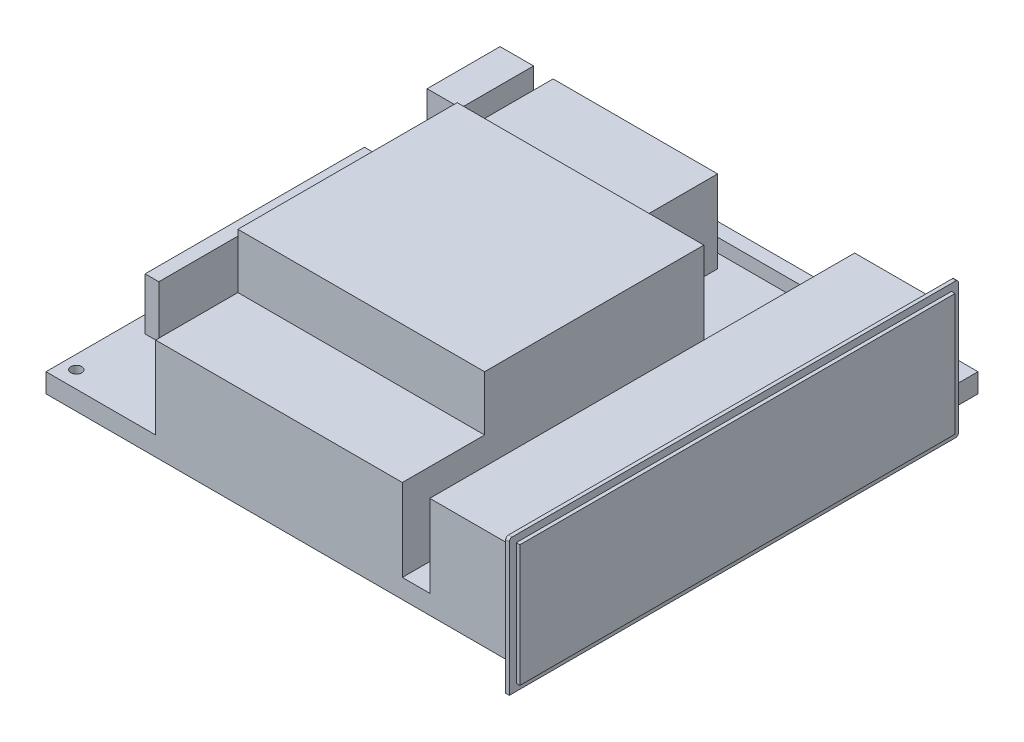
from build123d import *

# Parameters (mm, degrees)
SKETCH1_W                          = 170
SKETCH1_H                          = 170
ALUSPLAAT_DEPTH                    = 2
SKETCH2_W                          = 30
SKETCH2_H                          = 155
PISTIKUD_DEPTH                     = 35
SKETCH3_W                          = 90
SKETCH3_H                          = 110
CPU_M_LUD_DEPTH                    = 55
SKETCH4_W                          = 60
SKETCH4_H                          = 35
SININE_RADIKAS_DEPTH               = 35
SKETCH5_W                          = 90
SKETCH5_H                          = 5
PCIE_PESA_DEPTH                    = 10
SKETCH6_W                          = 12.216790721
SKETCH6_H                          = 26.62710746
RAID_PESAD_DEPTH                   = 30
SKETCH7_W                          = 170
SKETCH7_H                          = 170
LE_LDINE_M_RA_DEPTH                = 5
SKETCH8_W                          = 5
SKETCH8_H                          = 80
PATREI_JA_IGASUGUSED_L_LITID_DEPTH = 19
SKETCH9_OUTSIDE_W                  = 221.416
SKETCH9_OUTSIDE_H                  = 221.416
SKETCH9_OUTSIDE_W_2                = 90
SKETCH9_OUTSIDE_H_2                = 80
M_LUD_DEPTH                        = 20
CUT_EXTRUDE2_REACH                 = 132.192
SKETCH10_R                         = 1.98
BOSS_EXTRUDE1_DEPTH                = 1.32
SKETCH12_W                         = 158.75
SKETCH12_H                         = 44.45
BOSS_EXTRUDE2_DEPTH                = 1.32


with BuildPart() as part:
    # Sketch1 → alusplaat (new body)
    with BuildSketch(Plane(origin=(0, 0, 0), x_dir=(1, 0, 0), z_dir=(0, 1, 0))):
        Rectangle(SKETCH1_W, SKETCH1_H)
    extrude(amount=ALUSPLAAT_DEPTH)

    # Sketch2 → pistikud (add)
    with BuildSketch(Plane(origin=(0, 2, 0), x_dir=(-1, 0, 0), z_dir=(0, 1, 0))):
        with Locations((-70, 7.5)):
            Rectangle(SKETCH2_W, SKETCH2_H)
    extrude(amount=PISTIKUD_DEPTH)

    # Sketch3 → cpu+mälud (add)
    with BuildSketch(Plane(origin=(0, 2, 0), x_dir=(1, 0, 0), z_dir=(0, 1, 0))):
        with Locations((0, -30)):
            Rectangle(SKETCH3_W, SKETCH3_H)
    extrude(amount=CPU_M_LUD_DEPTH)

    # Sketch4 → sinine radikas (add)
    with BuildSketch(Plane(origin=(0, 2, 0), x_dir=(1, 0, 0), z_dir=(0, 1, 0))):
        with Locations((-25, 52.5)):
            Rectangle(SKETCH4_W, SKETCH4_H)
    extrude(amount=SININE_RADIKAS_DEPTH)

    # Sketch5 → pcie pesa (add)
    with BuildSketch(Plane(origin=(0, 2, 0), x_dir=(-1, 0, 0), z_dir=(0, 1, 0))):
        with Locations((0, -77.5)):
            Rectangle(SKETCH5_W, SKETCH5_H)
    extrude(amount=PCIE_PESA_DEPTH)

    # Sketch6 → raid pesad (add)
    with BuildSketch(Plane(origin=(0, 2, 0), x_dir=(-1, 0, 0), z_dir=(0, 1, 0))):
        with Locations((73.780405742, -62.225935716)):
            Rectangle(SKETCH6_W, SKETCH6_H)
    extrude(amount=RAID_PESAD_DEPTH)

    # Sketch7 → üleüldine müra (add)
    with BuildSketch(Plane(origin=(0, 2, 0), x_dir=(-1, 0, 0), z_dir=(0, 1, 0))):
        Rectangle(SKETCH7_W, SKETCH7_H)
    extrude(amount=LE_LDINE_M_RA_DEPTH)

    # Sketch8 → patrei ja igasugused lülitid (add)
    with BuildSketch(Plane(origin=(0, 7, 0), x_dir=(-1, 0, 0), z_dir=(0, 1, 0))):
        with Locations((76.340130234, 15)):
            Rectangle(SKETCH8_W, SKETCH8_H)
    extrude(amount=PATREI_JA_IGASUGUSED_L_LITID_DEPTH)

    # Sketch9 outside → mälud (cut)
    with BuildSketch(Plane(origin=(0, 57, 0), x_dir=(-1, 0, 0), z_dir=(0, 1, 0))):
        Rectangle(SKETCH9_OUTSIDE_W, SKETCH9_OUTSIDE_H)
        with Locations((0, 15)):
            Rectangle(SKETCH9_OUTSIDE_W_2, SKETCH9_OUTSIDE_H_2, mode=Mode.SUBTRACT)
    extrude(amount=-M_LUD_DEPTH, mode=Mode.SUBTRACT)

    # Sketch10 → Cut-Extrude2 (cut, up to next)
    with BuildSketch(Plane(origin=(0, 7, 0), x_dir=(1, 0, 0), z_dir=(0, 1, 0)), mode=Mode.PRIVATE) as cut_extrude2_sk1:
        with Locations((74.84, 78.65)):
            Circle(SKETCH10_R)
    cut_extrude2_tool1 = extrude(cut_extrude2_sk1.sketch, amount=-CUT_EXTRUDE2_REACH, mode=Mode.PRIVATE) & part.part
    # Sketch10 → Cut-Extrude2 (cut, up to next)
    with BuildSketch(Plane(origin=(0, 7, 0), x_dir=(1, 0, 0), z_dir=(0, 1, 0)), mode=Mode.PRIVATE) as cut_extrude2_sk2:
        with Locations((-80.1, 78.65)):
            Circle(SKETCH10_R)
    cut_extrude2_tool2 = extrude(cut_extrude2_sk2.sketch, amount=-CUT_EXTRUDE2_REACH, mode=Mode.PRIVATE) & part.part
    # Sketch10 → Cut-Extrude2 (cut, up to next)
    with BuildSketch(Plane(origin=(0, 7, 0), x_dir=(1, 0, 0), z_dir=(0, 1, 0)), mode=Mode.PRIVATE) as cut_extrude2_sk3:
        with Locations((-80.1, -78.83)):
            Circle(SKETCH10_R)
    cut_extrude2_tool3 = extrude(cut_extrude2_sk3.sketch, amount=-CUT_EXTRUDE2_REACH, mode=Mode.PRIVATE) & part.part
    # Sketch10 → Cut-Extrude2 (cut, up to next)
    with BuildSketch(Plane(origin=(0, 7, 0), x_dir=(1, 0, 0), z_dir=(0, 1, 0)), mode=Mode.PRIVATE) as cut_extrude2_sk4:
        with Locations((51.98, -78.83)):
            Circle(SKETCH10_R)
    cut_extrude2_tool4 = extrude(cut_extrude2_sk4.sketch, amount=-CUT_EXTRUDE2_REACH, mode=Mode.PRIVATE) & part.part
    add(cut_extrude2_tool1.solids().sort_by_distance((74.84, 7, -78.65))[0], mode=Mode.SUBTRACT)
    add(cut_extrude2_tool2.solids().sort_by_distance((-80.1, 7, -78.65))[0], mode=Mode.SUBTRACT)
    add(cut_extrude2_tool3.solids().sort_by_distance((-80.1, 7, 78.83))[0], mode=Mode.SUBTRACT)
    add(cut_extrude2_tool4.solids().sort_by_distance((51.98, 7, 78.83))[0], mode=Mode.SUBTRACT)


with BuildPart() as body_2:
    # Sketch11 → Boss-Extrude1 (new body)
    with BuildSketch(Plane(origin=(87.11, 0, 0), x_dir=(0, 0, -1), z_dir=(1, 0, 0))):
        with BuildLine():
            Line((-88.415, 43.18), (73.415, 43.18))
            ThreePointArc((73.415, 43.18), (74.122106781, 42.887106781), (74.415, 42.18))
            Line((74.415, 42.18), (74.415, -5.35))
            ThreePointArc((74.415, -5.35), (74.122106781, -6.057106781), (73.415, -6.35))
            Line((73.415, -6.35), (-89.415, -6.35))
            Line((-89.415, -6.35), (-89.415, 42.18))
            ThreePointArc((-89.415, 42.18), (-89.122106781, 42.887106781), (-88.415, 43.18))
        make_face()
    extrude(amount=BOSS_EXTRUDE1_DEPTH)


with BuildPart() as body_3:
    # Sketch12 → Boss-Extrude2 (new body)
    with BuildSketch(Plane(origin=(88.43, 0, 0), x_dir=(0, 0, -1), z_dir=(1, 0, 0))):
        with Locations((-7.5, 18.415)):
            Rectangle(SKETCH12_W, SKETCH12_H)
    extrude(amount=BOSS_EXTRUDE2_DEPTH)


solid = Compound([part.part, body_2.part, body_3.part])
